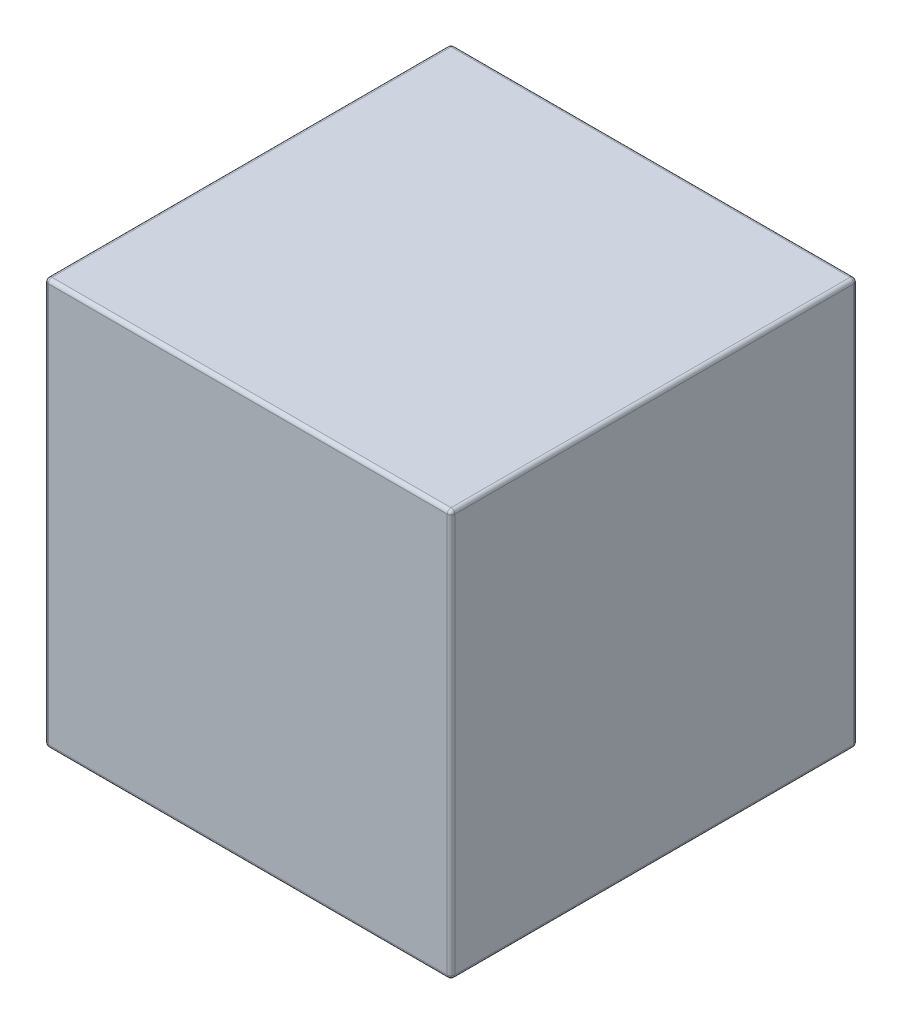
from build123d import *

# Parameters (mm, degrees)
ESQUISSE1_W               = 54
ESQUISSE1_H               = 54
BOSS_EXTRU_1_DEPTH        = 54
ESQUISSE2_W               = 10.5
ESQUISSE2_H               = 10.5
ENL_V_MAT_EXTRU_1_DEPTH   = 4.5
CONG_1_R                  = 0.5
SYM_TRIE2_COPY_1_SKETCH_W = 10.5
SYM_TRIE2_COPY_1_SKETCH_H = 10.5
SYM_TRIE2_COPY_1_DEPTH    = 4.5
SYM_TRIE2_COPY_2_SKETCH_W = 10.5
SYM_TRIE2_COPY_2_SKETCH_H = 10.5
SYM_TRIE2_COPY_2_DEPTH    = 4.5


with BuildPart() as part:
    # Esquisse1 → Boss.-Extru.1 (new body)
    with BuildSketch(Plane.XY):
        with Locations((27, -27)):
            Rectangle(ESQUISSE1_W, ESQUISSE1_H)
    extrude(amount=BOSS_EXTRU_1_DEPTH)

    # Esquisse2 → Enlèv. mat.-Extru.1 (cut)
    with BuildSketch(Plane.XZ.offset(54)):
        with Locations((27, 45.75)):
            Rectangle(ESQUISSE2_W, ESQUISSE2_H)
        with Locations((42.75, 27)):
            Rectangle(ESQUISSE2_W, ESQUISSE2_H)
    enl_v_mat_extru_1 = extrude(amount=-ENL_V_MAT_EXTRU_1_DEPTH, mode=Mode.SUBTRACT)

    # Congé1
    cong_1_edges = [part.edges().sort_by_distance(p)[0] for p in [
        (0, -54, 27),
        (27, -54, 54),
        (0, -27, 54),
        (54, -54, 27),
        (54, -27, 54),
        (27, -54, 0),
        (54, -27, 0),
        (0, -27, 0),
        (54, 0, 27),
        (27, 0, 54),
        (0, 0, 27),
        (27, 0, 0),
    ]]
    fillet(cong_1_edges, radius=CONG_1_R)

    # Symétrie1: Enlèv. mat.-Extru.1 across plane
    add(enl_v_mat_extru_1.mirror(Plane.XY.offset(27)), mode=Mode.SUBTRACT)

    # Symétrie2 copy 1 sketch → Symétrie2 copy 1 (cut)
    with BuildSketch(Plane(origin=(54, -54, 54), x_dir=(-1, 0, 0), z_dir=(0, -1, 0))):
        with Locations((27, 45.75)):
            Rectangle(SYM_TRIE2_COPY_1_SKETCH_W, SYM_TRIE2_COPY_1_SKETCH_H)
        with Locations((42.75, 27)):
            Rectangle(SYM_TRIE2_COPY_1_SKETCH_W, SYM_TRIE2_COPY_1_SKETCH_H)
    extrude(amount=-SYM_TRIE2_COPY_1_DEPTH, mode=Mode.SUBTRACT)

    # Symétrie2 copy 2 sketch → Symétrie2 copy 2 (cut)
    with BuildSketch(Plane(origin=(54, -54, 0), x_dir=(-1, 0, 0), z_dir=(0, -1, 0))):
        with Locations((27, -45.75)):
            Rectangle(SYM_TRIE2_COPY_2_SKETCH_W, SYM_TRIE2_COPY_2_SKETCH_H)
        with Locations((42.75, -27)):
            Rectangle(SYM_TRIE2_COPY_2_SKETCH_W, SYM_TRIE2_COPY_2_SKETCH_H)
    extrude(amount=-SYM_TRIE2_COPY_2_DEPTH, mode=Mode.SUBTRACT)


solid = part.part
